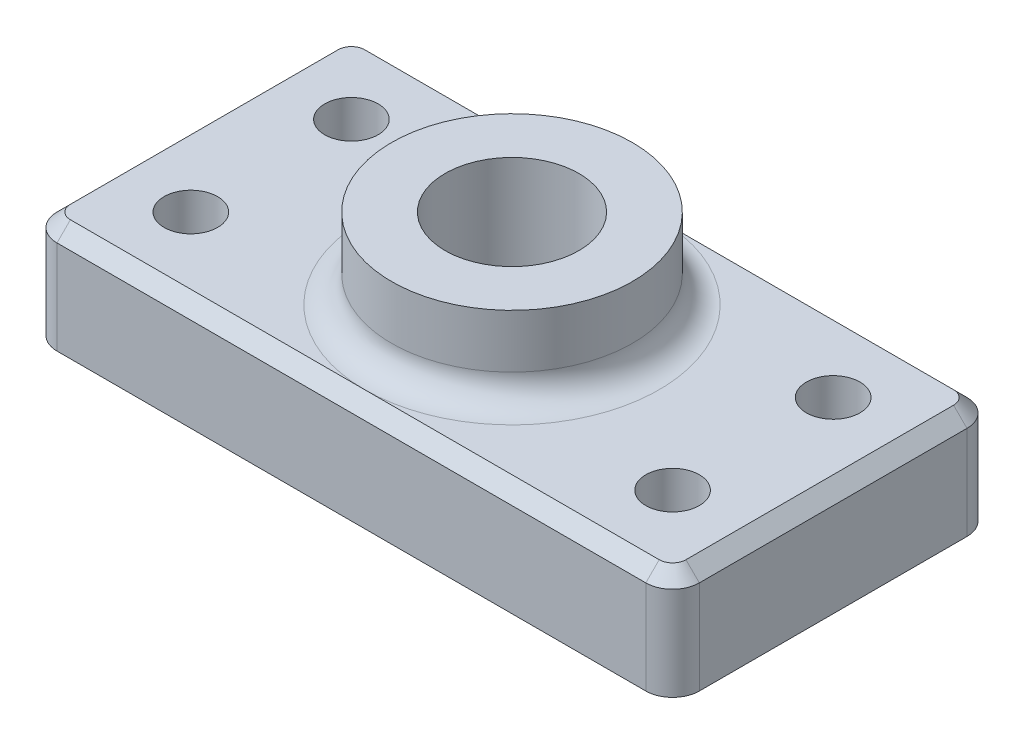
from build123d import *

# Parameters (mm, degrees)
SKETCH1_W           = 152.4
SKETCH1_H           = 76.2
BOSS_EXTRUDE1_DEPTH = 25.4
SKETCH2_R           = 6.35
CUT_EXTRUDE1_DEPTH  = 89.9
SKETCH3_R           = 28.575
BOSS_EXTRUDE2_DEPTH = 19.05
SKETCH4_R           = 15.875
CUT_EXTRUDE3_DEPTH  = 97.092936785
FILLET1_R           = 6.35
CHAMFER1_SIZE       = 3.175


with BuildPart() as part:
    # Sketch1 → Boss-Extrude1 (new body)
    with BuildSketch(Plane(origin=(0, 0, 0), x_dir=(1, 0, 0), z_dir=(0, 1, 0))):
        Rectangle(SKETCH1_W, SKETCH1_H)
    extrude(amount=BOSS_EXTRUDE1_DEPTH)

    # Sketch2 → Cut-Extrude1 (cut, through all)
    with BuildSketch(Plane(origin=(0, 25.4, 0), x_dir=(1, 0, 0), z_dir=(0, 1, 0))):
        with Locations(Location((-57.15, 19.05, 0), (0, 0, 270))):
            Circle(SKETCH2_R)
        with Locations(Location((-57.15, -19.05, 0), (0, 0, 90))):
            Circle(SKETCH2_R)
        with Locations(Location((57.15, -19.05, 0), (0, 0, 270))):
            Circle(SKETCH2_R)
        with Locations(Location((57.15, 19.05, 0), (0, 0, 90))):
            Circle(SKETCH2_R)
    extrude(amount=-CUT_EXTRUDE1_DEPTH, mode=Mode.SUBTRACT)

    # Sketch3 → Boss-Extrude2 (add)
    with BuildSketch(Plane(origin=(0, 25.4, 0), x_dir=(1, 0, 0), z_dir=(0, 1, 0))):
        with Locations(Location((0, 0, 0), (0, 0, 90))):
            Circle(SKETCH3_R)
    extrude(amount=BOSS_EXTRUDE2_DEPTH)

    # Sketch4 → Cut-Extrude3 (cut, through all)
    with BuildSketch(Plane(origin=(0, 44.45, 0), x_dir=(1, 0, 0), z_dir=(0, 1, 0))):
        with Locations(Location((0, 0, 0), (0, 0, 270))):
            Circle(SKETCH4_R)
    extrude(amount=-CUT_EXTRUDE3_DEPTH, mode=Mode.SUBTRACT)

    # Fillet1
    fillet1_edges = [part.edges().sort_by_distance(p)[0] for p in [
        (0, 25.4, 28.575),
        (76.2, 12.7, 38.1),
        (-76.2, 12.7, 38.1),
        (-76.2, 12.7, -38.1),
        (76.2, 12.7, -38.1),
    ]]
    fillet(fillet1_edges, radius=FILLET1_R)

    # Chamfer1
    chamfer1_edges = [part.edges().sort_by_distance(p)[0] for p in [
        (76.2, 25.4, 0),
        (0, 25.4, -38.1),
        (-76.2, 25.4, 0),
        (0, 25.4, 38.1),
        (-74.340128061, 25.4, 36.240128061),
        (74.340128061, 25.4, 36.240128061),
        (74.340128061, 25.4, -36.240128061),
        (-74.340128061, 25.4, -36.240128061),
    ]]
    chamfer(chamfer1_edges, length=CHAMFER1_SIZE - 0.0001)  # a hair under: the kernel refuses the full size


solid = part.part
